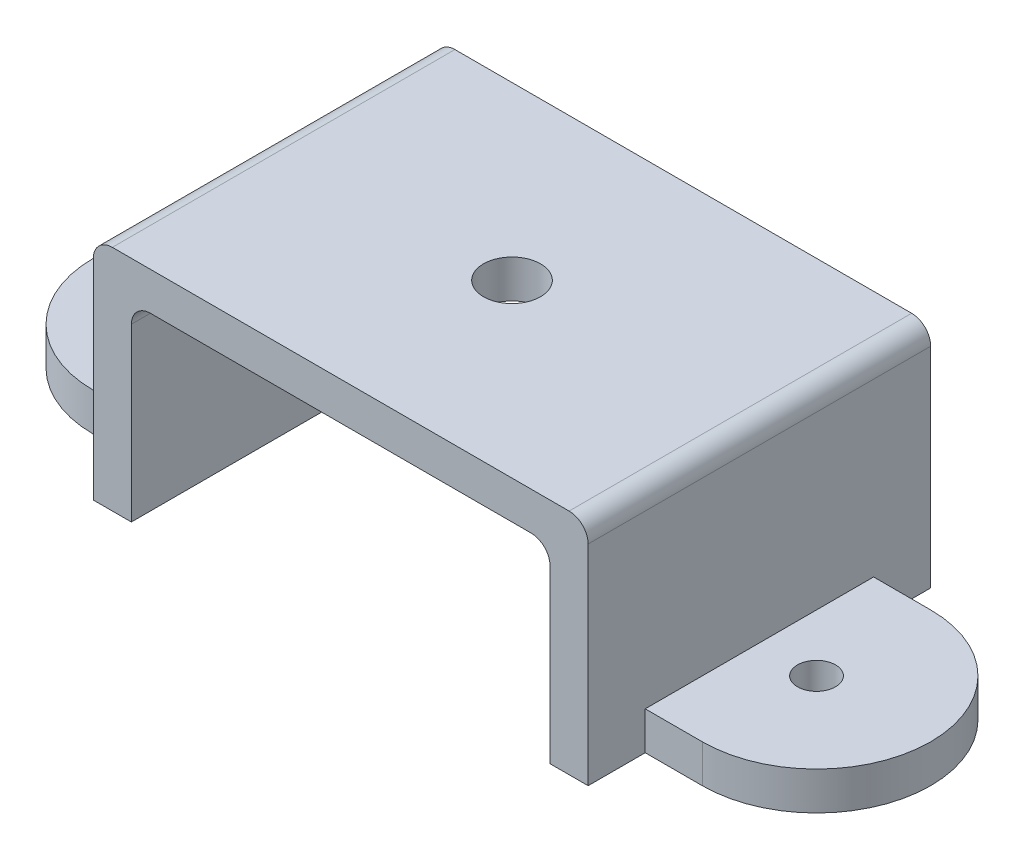
from build123d import *

# Parameters (mm, degrees)
BOSS_EXTRUDE1_DEPTH      = 12.7
BOSS_EXTRUDE2_DEPTH      = 57.15
BOSS_EXTRUDE2_DEPTH_BACK = 57.15
SKETCH8_R                = 9.525
CUT_EXTRUDE2_DEPTH       = 170.081792337
SKETCH9_W                = 139.7
SKETCH9_H                = 63.5
CUT_EXTRUDE3_DEPTH       = 196.926057481
FILLET1_R                = 6.35
SKETCH10_R               = 6.35
CUT_EXTRUDE4_DEPTH       = 164.751221369


with BuildPart() as part:
    # Sketch1 → Boss-Extrude1 (new body)
    with BuildSketch(Plane(origin=(0, 0, 0), x_dir=(1, 0, 0), z_dir=(0, 1, 0))):
        with BuildLine():
            Line((101.6, 38.1), (-101.6, 38.1))
            ThreePointArc((-101.6, 38.1), (-139.7, 0), (-101.6, -38.1))
            Line((-101.6, -38.1), (101.6, -38.1))
            ThreePointArc((101.6, -38.1), (139.7, 0), (101.6, 38.1))
        make_face()
    extrude(amount=BOSS_EXTRUDE1_DEPTH)

    # Sketch2 → Boss-Extrude2 (add, two sides: drawn at the far end of the back side and taken through both)
    with BuildSketch(Plane.XY.offset(-BOSS_EXTRUDE2_DEPTH_BACK)):
        Polygon((-82.55, 76.2), (-82.55, 0), (-69.85, 0), (-69.85, 63.5), (69.85, 63.5), (69.85, 0), (82.55, 0), (82.55, 76.2), align=None)
    extrude(amount=BOSS_EXTRUDE2_DEPTH + BOSS_EXTRUDE2_DEPTH_BACK)

    # Sketch8 → Cut-Extrude2 (cut, through all)
    with BuildSketch(Plane(origin=(0, 0, 0), x_dir=(1, 0, 0), z_dir=(0, 1, 0))):
        Circle(SKETCH8_R)
    extrude(amount=CUT_EXTRUDE2_DEPTH, mode=Mode.SUBTRACT)

    # Sketch9 → Cut-Extrude3 (cut, through all)
    with BuildSketch(Plane.XY.offset(57.15)):
        with Locations((0, 31.75)):
            Rectangle(SKETCH9_W, SKETCH9_H)
    extrude(amount=-CUT_EXTRUDE3_DEPTH, mode=Mode.SUBTRACT)

    # Fillet1
    fillet1_edges = [part.edges().sort_by_distance(p)[0] for p in [
        (-69.85, 63.5, 0),
        (69.85, 63.5, 0),
        (82.55, 76.2, 0),
        (-82.55, 76.2, 0),
    ]]
    fillet(fillet1_edges, radius=FILLET1_R)

    # Sketch10 → Cut-Extrude4 (cut, through all)
    with BuildSketch(Plane(origin=(0, 12.7, 0), x_dir=(1, 0, 0), z_dir=(0, 1, 0))):
        with Locations((101.6, 0)):
            Circle(SKETCH10_R)
        with Locations((-101.6, 0)):
            Circle(SKETCH10_R)
    extrude(amount=-CUT_EXTRUDE4_DEPTH, mode=Mode.SUBTRACT)


solid = part.part
